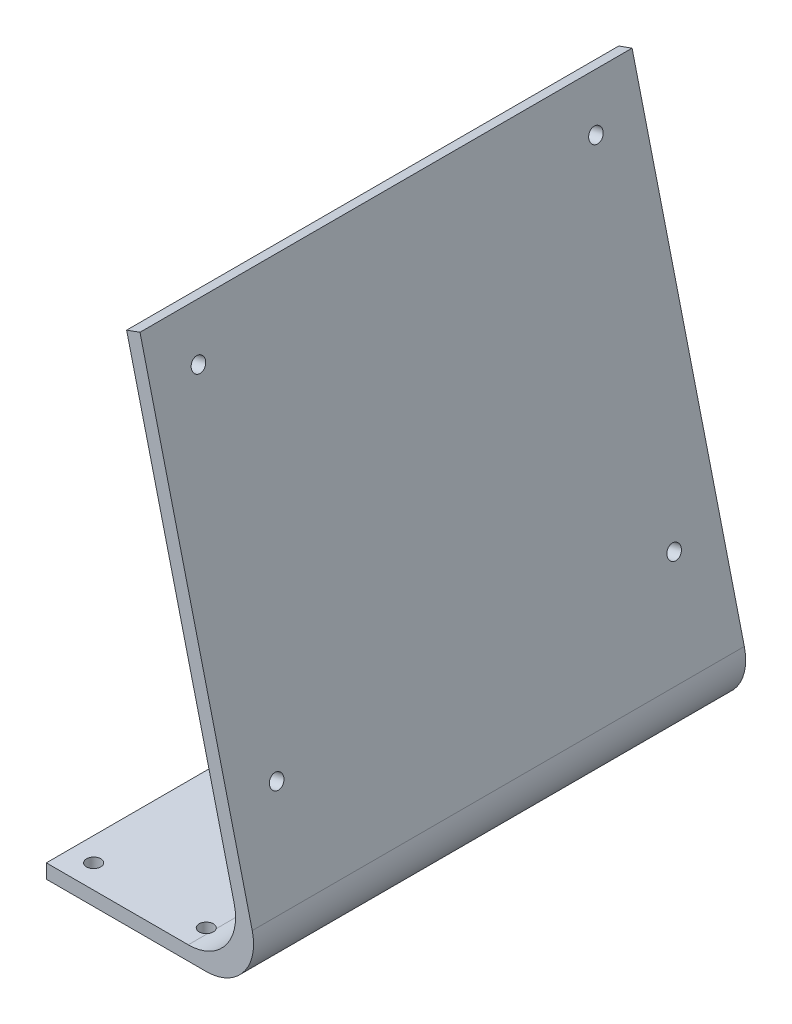
from build123d import *

# Parameters (mm, degrees)
BOSS_EXTRUDE1_DEPTH = 52
CUT_EXTRUDE_1_REACH = 133.119
SKETCH_2_R          = 1.5
CUT_EXTRUDE1_REACH  = 133.747
SKETCH2_R           = 1.5


with BuildPart() as part:
    # Sketch1 → Boss-Extrude1 (new, symmetric)
    with BuildSketch(Plane.XY):
        with BuildLine():
            Line((-50.530004832, 0), (-50.530004832, 3))
            Line((-50.530004832, 3), (-20.530004832, 3))
            ThreePointArc((-20.530004832, 3), (-12.668388321, 6.819790793), (-10.812717884, 15.361002831))
            Line((-10.812717884, 15.361002831), (-33.559523327, 108.981066609))
            Line((-33.559523327, 108.981066609), (-30.737861628, 110))
            Line((-30.737861628, 110), (-7.014578577, 12.361002831))
            ThreePointArc((-7.014578577, 12.361002831), (-8.870249014, 3.819790793), (-16.731865525, 0))
            Line((-16.731865525, 0), (-50.530004832, 0))
        make_face()
    extrude(amount=BOSS_EXTRUDE1_DEPTH, both=True)

    # Эскиз2 → Вырез-Вытянуть1 (cut, up to next)
    with BuildSketch(Plane(origin=(-3.787634246, -0.920279007, 0), x_dir=(0, 0, -1), z_dir=(0.9717286948053454, 0.23610028312541273, 0)), mode=Mode.PRIVATE) as cut_extrude_1_sk1:
        with Locations((-42, 104.147374262)):
            Circle(SKETCH_2_R)
    cut_extrude_1_tool1 = extrude(cut_extrude_1_sk1.sketch, amount=-CUT_EXTRUDE_1_REACH, mode=Mode.PRIVATE) & part.part
    # Эскиз2 → Вырез-Вытянуть1 (cut, up to next)
    with BuildSketch(Plane(origin=(-3.787634246, -0.920279007, 0), x_dir=(0, 0, -1), z_dir=(0.9717286948053454, 0.23610028312541273, 0)), mode=Mode.PRIVATE) as cut_extrude_1_sk2:
        with Locations((42, 104.147374262)):
            Circle(SKETCH_2_R)
    cut_extrude_1_tool2 = extrude(cut_extrude_1_sk2.sketch, amount=-CUT_EXTRUDE_1_REACH, mode=Mode.PRIVATE) & part.part
    # Эскиз2 → Вырез-Вытянуть1 (cut, up to next)
    with BuildSketch(Plane(origin=(-3.787634246, -0.920279007, 0), x_dir=(0, 0, -1), z_dir=(0.9717286948053454, 0.23610028312541273, 0)), mode=Mode.PRIVATE) as cut_extrude_1_sk3:
        with Locations((42, 34.147374262)):
            Circle(SKETCH_2_R)
    cut_extrude_1_tool3 = extrude(cut_extrude_1_sk3.sketch, amount=-CUT_EXTRUDE_1_REACH, mode=Mode.PRIVATE) & part.part
    # Эскиз2 → Вырез-Вытянуть1 (cut, up to next)
    with BuildSketch(Plane(origin=(-3.787634246, -0.920279007, 0), x_dir=(0, 0, -1), z_dir=(0.9717286948053454, 0.23610028312541273, 0)), mode=Mode.PRIVATE) as cut_extrude_1_sk4:
        with Locations((-42, 34.147374262)):
            Circle(SKETCH_2_R)
    cut_extrude_1_tool4 = extrude(cut_extrude_1_sk4.sketch, amount=-CUT_EXTRUDE_1_REACH, mode=Mode.PRIVATE) & part.part
    add(cut_extrude_1_tool1.solids().sort_by_distance((-28.376859, 100.282713, 42))[0], mode=Mode.SUBTRACT)
    add(cut_extrude_1_tool2.solids().sort_by_distance((-28.376859, 100.282713, -42))[0], mode=Mode.SUBTRACT)
    add(cut_extrude_1_tool3.solids().sort_by_distance((-11.849839, 32.261704, -42))[0], mode=Mode.SUBTRACT)
    add(cut_extrude_1_tool4.solids().sort_by_distance((-11.849839, 32.261704, 42))[0], mode=Mode.SUBTRACT)

    # Sketch2 → Cut-Extrude1 (cut, up to next)
    with BuildSketch(Plane.XZ, mode=Mode.PRIVATE) as cut_extrude1_sk1:
        with Locations((-45.530004832, 47)):
            Circle(SKETCH2_R)
    cut_extrude1_tool1 = extrude(cut_extrude1_sk1.sketch, amount=-CUT_EXTRUDE1_REACH, mode=Mode.PRIVATE) & part.part
    # Sketch2 → Cut-Extrude1 (cut, up to next)
    with BuildSketch(Plane.XZ, mode=Mode.PRIVATE) as cut_extrude1_sk2:
        with Locations((-21.730004832, 47)):
            Circle(SKETCH2_R)
    cut_extrude1_tool2 = extrude(cut_extrude1_sk2.sketch, amount=-CUT_EXTRUDE1_REACH, mode=Mode.PRIVATE) & part.part
    # Sketch2 → Cut-Extrude1 (cut, up to next)
    with BuildSketch(Plane.XZ, mode=Mode.PRIVATE) as cut_extrude1_sk3:
        with Locations((-21.730004832, -47)):
            Circle(SKETCH2_R)
    cut_extrude1_tool3 = extrude(cut_extrude1_sk3.sketch, amount=-CUT_EXTRUDE1_REACH, mode=Mode.PRIVATE) & part.part
    # Sketch2 → Cut-Extrude1 (cut, up to next)
    with BuildSketch(Plane.XZ, mode=Mode.PRIVATE) as cut_extrude1_sk4:
        with Locations((-45.530004832, -47)):
            Circle(SKETCH2_R)
    cut_extrude1_tool4 = extrude(cut_extrude1_sk4.sketch, amount=-CUT_EXTRUDE1_REACH, mode=Mode.PRIVATE) & part.part
    add(cut_extrude1_tool1.solids().sort_by_distance((-45.530005, 0, 47))[0], mode=Mode.SUBTRACT)
    add(cut_extrude1_tool2.solids().sort_by_distance((-21.730005, 0, 47))[0], mode=Mode.SUBTRACT)
    add(cut_extrude1_tool3.solids().sort_by_distance((-21.730005, 0, -47))[0], mode=Mode.SUBTRACT)
    add(cut_extrude1_tool4.solids().sort_by_distance((-45.530005, 0, -47))[0], mode=Mode.SUBTRACT)


solid = part.part
